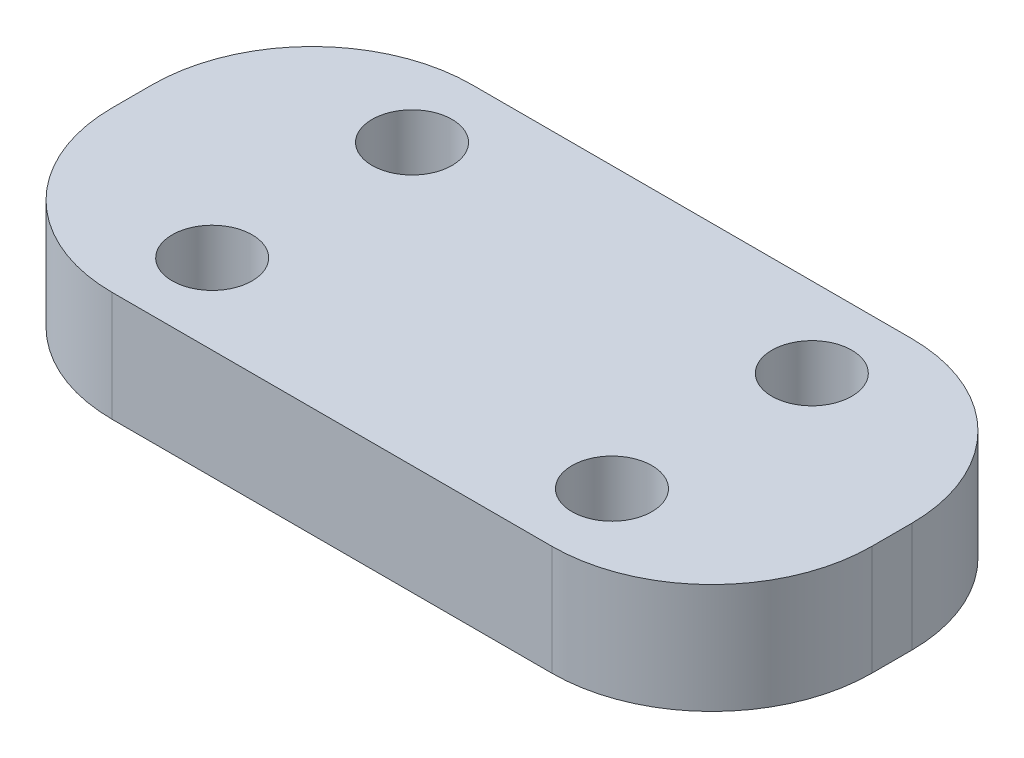
from build123d import *

# Parameters (mm, degrees)
ESBO_O1_R                = 2
RESSALTO_EXTRUS_O1_DEPTH = 2.75
FILETE1_R                = 8


with BuildPart() as part:
    # Esboço1 → Ressalto-extrusão1 (new, symmetric)
    with BuildSketch(Plane(origin=(0, 0, 0), x_dir=(1, 0, 0), z_dir=(0, 1, 0))):
        Polygon((-19, -4), (19, -4), (19, 4), (19, 14), (-19, 14), (-19, 4), align=None)
        with Locations((-10, 0)):
            Circle(ESBO_O1_R, mode=Mode.SUBTRACT)
        with Locations((10, 0)):
            Circle(ESBO_O1_R, mode=Mode.SUBTRACT)
        with Locations((-10, 10)):
            Circle(ESBO_O1_R, mode=Mode.SUBTRACT)
        with Locations((10, 10)):
            Circle(ESBO_O1_R, mode=Mode.SUBTRACT)
    extrude(amount=RESSALTO_EXTRUS_O1_DEPTH, both=True)

    # Filete1
    filete1_edges = [part.edges().sort_by_distance(p)[0] for p in [
        (-19, 0, 4),
        (19, 0, 4),
        (-19, 0, -14),
        (19, 0, -14),
    ]]
    fillet(filete1_edges, radius=FILETE1_R)


solid = part.part
